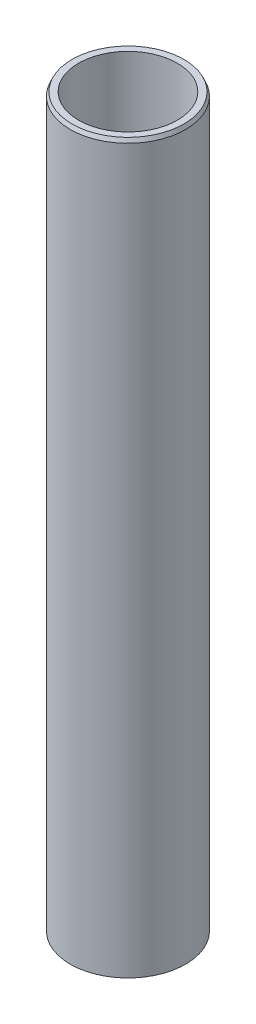
from build123d import *
from OCP.BRepFilletAPI import BRepFilletAPI_MakeChamfer

# Parameters (mm, degrees)
SKETCH1_R           = 47.5
BOSS_EXTRUDE1_DEPTH = 600
SKETCH2_R           = 40.685832666
CUT_EXTRUDE1_DEPTH  = 604.748706003
CHAMFER1_SIZE       = 3.238877609
CHAMFER1_SIZE2      = 1.422881858


with BuildPart() as part:
    # Sketch1 → Boss-Extrude1 (new body)
    with BuildSketch(Plane(origin=(0, 0, 0), x_dir=(1, 0, 0), z_dir=(0, 1, 0))):
        Circle(SKETCH1_R)
    extrude(amount=BOSS_EXTRUDE1_DEPTH)

    # Sketch2 → Cut-Extrude1 (cut, through all)
    with BuildSketch(Plane(origin=(0, 0, 0), x_dir=(1, 0, 0), z_dir=(0, 1, 0))):
        Circle(SKETCH2_R)
    extrude(amount=CUT_EXTRUDE1_DEPTH, mode=Mode.SUBTRACT)

    # Chamfer1: one chamfer whose edges measure the first distance from different faces: ONE call of the kernel's chamfer builder (chamfer() names one face for all edges)
    chamfer1_edges_1 = [part.edges().sort_by_distance(p)[0] for p in [
        (-47.5, 600, 0),
    ]]
    chamfer1_side_1 = [part.faces().sort_by_distance(p)[0] for p in [
        (-47.5, 300, 0),
    ]]
    chamfer1_edges_2 = [part.edges().sort_by_distance(p)[0] for p in [
        (-47.5, 0, 0),
    ]]
    chamfer1_side_2 = [part.faces().sort_by_distance(p)[0] for p in [
        (-46.156497116, 0, 0),
    ]]
    chamfer1 = BRepFilletAPI_MakeChamfer(part.part.solid().wrapped)
    for e in chamfer1_edges_1:
        chamfer1.Add(CHAMFER1_SIZE, CHAMFER1_SIZE2, e.wrapped, chamfer1_side_1[0].wrapped)  # the first distance lies on this face
    for e in chamfer1_edges_2:
        chamfer1.Add(CHAMFER1_SIZE, CHAMFER1_SIZE2, e.wrapped, chamfer1_side_2[0].wrapped)  # the first distance lies on this face
    add(Compound.cast(chamfer1.Shape()), mode=Mode.REPLACE)


solid = part.part
